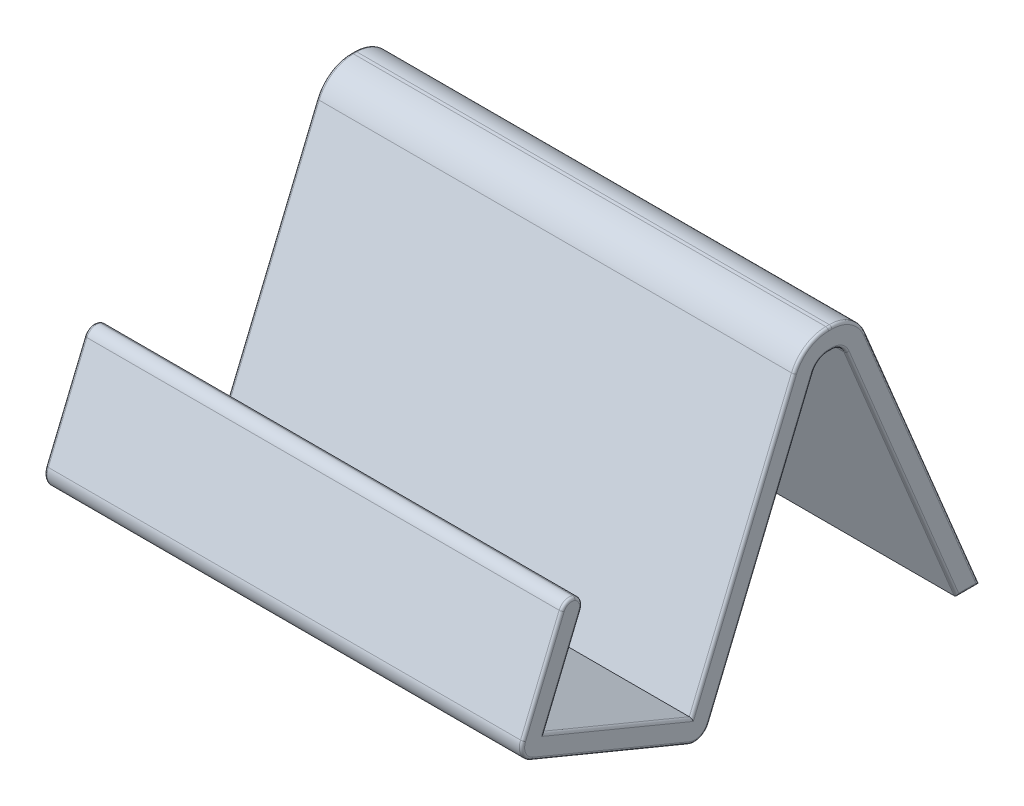
from build123d import *

# Parameters (mm, degrees)
BOSS_EXTRUDE1_DEPTH = 45
FILLET1_R           = 7
FILLET3_R           = 3
FILLET4_R           = 3
FILLET5_R           = 2
FILLET6_R           = 0.5


with BuildPart() as part:
    # Sketch1 → Boss-Extrude1 (new, symmetric)
    with BuildSketch(Plane(origin=(0, 0, 0), x_dir=(0, 0, -1), z_dir=(1, 0, 0))):
        Polygon((-20.062717328, 29.958093621), (-27.716385975, 11.480502971), (0, 0), (21.04758878, 50.813374288), (31.04758878, 50.813374288), (53.62591129, -3.69551813), (54.259961961, -5.22625186), (49.93039316, -5.22625186), (28.374874228, 46.813374288), (23.720303332, 46.813374288), (2.164784401, -5.22625186), (-32.942637835, 9.31571857), (-23.758235458, 31.488827351), align=None)
    extrude(amount=BOSS_EXTRUDE1_DEPTH, both=True)

    # Fillet1
    fillet1_edges = [part.edges().sort_by_distance(p)[0] for p in [
        (0, 50.813374288, -21.04758878),
        (0, 50.813374288, -31.04758878),
    ]]
    fillet(fillet1_edges, radius=FILLET1_R)

    # Fillet3
    fillet3_edges = [part.edges().sort_by_distance(p)[0] for p in [
        (0, 46.813374288, -28.374874228),
        (0, 46.813374288, -23.720303332),
    ]]
    fillet(fillet3_edges, radius=FILLET3_R)

    # Fillet4
    fillet4_edges = [part.edges().sort_by_distance(p)[0] for p in [
        (0, -5.22625186, -2.164784401),
        (0, 9.31571857, 32.942637835),
    ]]
    fillet(fillet4_edges, radius=FILLET4_R)

    # Fillet5
    fillet5_edges = [part.edges().sort_by_distance(p)[0] for p in [
        (0, 29.958093621, 20.062717328),
        (0, 31.488827351, 23.758235458),
    ]]
    fillet(fillet5_edges, radius=FILLET5_R - 0.0001)  # a hair under: the kernel refuses the full size

    # Fillet6
    fillet6_edges = [part.edges().sort_by_distance(p)[0] for p in [
        (-45, 19.795464958, 24.27221595),
        (-45, 5.740251485, 13.858192988),
        (-45, 20.632953228, -43.548728501),
        (-45, -5.22625186, -52.09517756),
        (45, -5.22625186, -52.09517756),
        (45, 20.632953228, -43.548728501),
        (-45, 23.246079157, -9.628841259),
        (45, 23.246079157, -9.628841259),
        (-45, 50.813374288, -26.04758878),
        (-45, 49.633661574, -30.259329946),
        (-45, 49.633661574, -21.835847614),
        (45, 50.813374288, -26.04758878),
        (45, 49.633661574, -30.259329946),
        (45, 49.633661574, -21.835847614),
        (45, 5.740251485, 13.858192988),
        (-45, 19.867586363, -39.536185036),
        (45, 19.867586363, -39.536185036),
        (-45, 46.813374288, -26.04758878),
        (45, 46.813374288, -26.04758878),
        (45, 19.795464958, 24.27221595),
        (-45, 46.307783125, -28.037049014),
        (45, 46.307783125, -28.037049014),
        (-45, 46.307783125, -24.058128546),
        (45, 46.307783125, -24.058128546),
        (-45, 2.044733355, 15.388926717),
        (45, 2.044733355, 15.388926717),
        (-45, 21.253405662, -13.133017673),
        (-45, -4.078201562, -1.689246397),
        (-45, 9.791256574, 31.794587538),
        (45, 21.253405662, -13.133017673),
        (45, -4.078201562, -1.689246397),
        (45, 9.791256574, 31.794587538),
        (-45, 20.864258921, 28.159075796),
        (-45, 30.723498754, 23.441225974),
        (-45, 29.641084137, 20.828045924),
        (45, 20.864258921, 28.159075796),
        (45, 30.723498754, 23.441225974),
        (45, 29.641084137, 20.828045924),
    ]]
    fillet(fillet6_edges, radius=FILLET6_R)


solid = part.part
